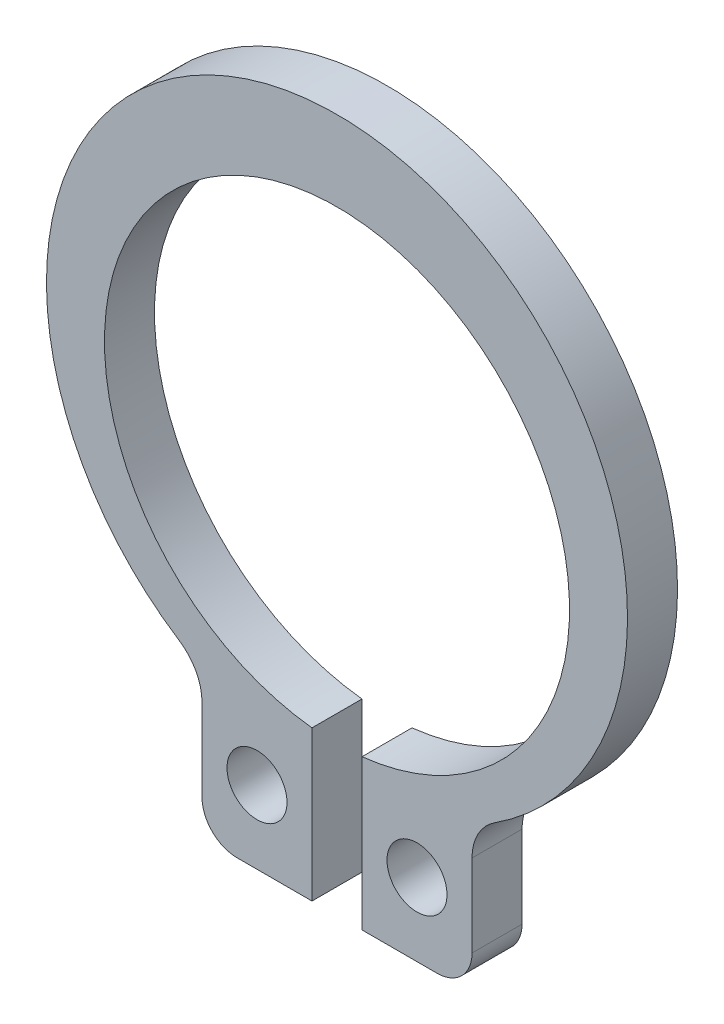
from build123d import *

# Parameters (mm, degrees)
BODYSKE_R      = 0.6
BASEBODY_DEPTH = 1
FILLET1_R      = 1
FILLET2_R      = 0.7


with BuildPart() as part:
    # BodySke → BaseBody (new body)
    with BuildSketch(Plane.XY):
        with BuildLine():
            Line((-0.5, -4.623040125), (-0.5, -7.623040125))
            Line((-0.5, -7.623040125), (-2.7, -7.623040125))
            Line((-2.7, -7.623040125), (-2.7, -4.704521358))
            ThreePointArc((-2.7, -4.704521358), (0, 6.25), (2.7, -4.704521358))
            Line((2.7, -4.704521358), (2.7, -7.623040125))
            Line((2.7, -7.623040125), (0.5, -7.623040125))
            Line((0.5, -7.623040125), (0.5, -4.623040125))
            ThreePointArc((0.5, -4.623040125), (0, 4.65), (-0.5, -4.623040125))
        make_face()
        with Locations((-1.6, -6.163780742)):
            Circle(BODYSKE_R, mode=Mode.SUBTRACT)
        with Locations((1.6, -6.163780742)):
            Circle(BODYSKE_R, mode=Mode.SUBTRACT)
    extrude(amount=BASEBODY_DEPTH)

    # Fillet1
    fillet1_edges = [part.edges().sort_by_distance(p)[0] for p in [
        (2.7, -4.704521358, 0.5),
        (-2.7, -4.704521358, 0.5),
    ]]
    fillet(fillet1_edges, radius=FILLET1_R)

    # Fillet2
    fillet2_edges = [part.edges().sort_by_distance(p)[0] for p in [
        (2.7, -7.623040125, 0.5),
        (-2.7, -7.623040125, 0.5),
    ]]
    fillet(fillet2_edges, radius=FILLET2_R)


solid = part.part
